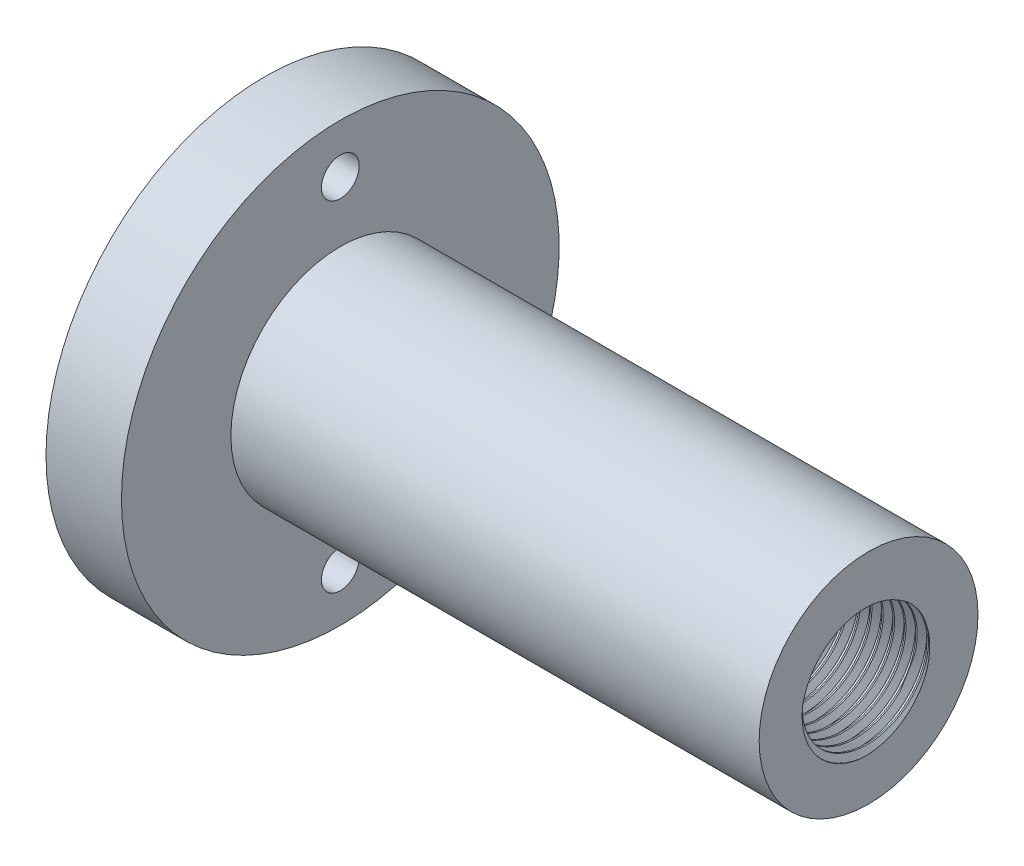
from build123d import *

# Parameters (mm, degrees)
CUT_EXTRUDE1_REACH             = 91.9
SKETCH2_R                      = 2.5
CUT_EXTRUDE1_DIRECTION_2_DEPTH = 90.899944383
THREAD1_PITCH                  = 1.5


with BuildPart() as part:
    # Sketch1 → Revolve1 (revolve)
    with BuildSketch(Plane.XY, mode=Mode.PRIVATE) as revolve1_sk:
        Polygon((-48, 29), (-38, 29), (-38, 14.5), (32, 14.5), (32, 8), (0, 8), (0, 13), (-44, 13), (-48, 17), align=None)
    revolve(revolve1_sk.sketch.rotate(Axis((0, 0, 0), (1, 0, 0)), 90), axis=Axis((0, 0, 0), (1, 0, 0)))

    # Sketch2 → Cut-Extrude1 (cut, up to next)
    with BuildSketch(Plane.ZY.offset(48), mode=Mode.PRIVATE) as cut_extrude1_sk1:
        with Locations(Location((0, 22.5, 0), (0, 0, 180))):
            Circle(SKETCH2_R)
    cut_extrude1_tool1 = extrude(cut_extrude1_sk1.sketch, amount=-CUT_EXTRUDE1_REACH, mode=Mode.PRIVATE) & part.part
    # Sketch2 → Cut-Extrude1 (cut, up to next)
    with BuildSketch(Plane.ZY.offset(48), mode=Mode.PRIVATE) as cut_extrude1_sk2:
        with Locations(Location((0, -22.5, 0), (0, 0, 180))):
            Circle(SKETCH2_R)
    cut_extrude1_tool2 = extrude(cut_extrude1_sk2.sketch, amount=-CUT_EXTRUDE1_REACH, mode=Mode.PRIVATE) & part.part
    add(cut_extrude1_tool1.solids().sort_by_distance((-48, 22.5, 0))[0], mode=Mode.SUBTRACT)
    add(cut_extrude1_tool2.solids().sort_by_distance((-48, -22.5, 0))[0], mode=Mode.SUBTRACT)

    # Sketch2 → Cut-Extrude1 direction 2 (cut)
    with BuildSketch(Plane.ZY.offset(48)):
        with Locations(Location((0, 22.5, 0), (0, 0, 180))):
            Circle(SKETCH2_R)
        with Locations(Location((0, -22.5, 0), (0, 0, 180))):
            Circle(SKETCH2_R)
    extrude(amount=CUT_EXTRUDE1_DIRECTION_2_DEPTH, mode=Mode.SUBTRACT)

    # Thread1: the profile of Thread Profile1 profile screwed along a right-hand helix of 103.333333 turns, 6 arcs to a turn; built about Z, then put on its axis
    thread1_z = Axis((0, 0, 0), (0, 0, 1))
    thread1_corners = [(7.9997, 0, -0.000173205), (7.9997, 0, 1.312673201), (8.811898812, 0, 0.843749998), (8.811898812, 0, 0.468749998)]
    with BuildLine(mode=Mode.PRIVATE) as thread1_profile:
        Line(thread1_corners[0], thread1_corners[1])
        Line(thread1_corners[1], thread1_corners[2])
        Line(thread1_corners[2], thread1_corners[3])
        Line(thread1_corners[3], thread1_corners[0])
    thread1_cap = Face(thread1_profile.wire())
    thread1_turn_angles = [0, 30, 60, 90, 120, 150, 180, 210, 240, 270, 300, 330, 360, 390, 420, 450, 480, 510, 540, 570, 600, 630, 660, 690, 720, 750, 780, 810, 840, 870, 900, 930, 960, 990, 1020, 1050, 1080, 1110, 1140, 1170, 1200, 1230, 1260, 1290, 1320, 1350, 1380, 1410, 1440]
    thread1_turn_weights = [1, 0.8660254037844387, 1, 0.8660254037844387, 1, 0.8660254037844387, 1, 0.8660254037844387, 1, 0.8660254037844387, 1, 0.8660254037844387, 1, 0.8660254037844387, 1, 0.8660254037844387, 1, 0.8660254037844387, 1, 0.8660254037844387, 1, 0.8660254037844387, 1, 0.8660254037844387, 1, 0.8660254037844387, 1, 0.8660254037844387, 1, 0.8660254037844387, 1, 0.8660254037844387, 1, 0.8660254037844387, 1, 0.8660254037844387, 1, 0.8660254037844387, 1, 0.8660254037844387, 1, 0.8660254037844387, 1, 0.8660254037844387, 1, 0.8660254037844387, 1, 0.8660254037844387, 1]
    thread1_turn_rails = [Edge.make_bspline([Vector(p[0], p[1], 0).rotate(thread1_z, thread1_turn_angles[k]) / thread1_turn_weights[k] + Vector(0, 0, p[2] + THREAD1_PITCH * thread1_turn_angles[k] / 360) for k in range(49)], [0, 0, 0, 1, 1, 2, 2, 3, 3, 4, 4, 5, 5, 6, 6, 7, 7, 8, 8, 9, 9, 10, 10, 11, 11, 12, 12, 13, 13, 14, 14, 15, 15, 16, 16, 17, 17, 18, 18, 19, 19, 20, 20, 21, 21, 22, 22, 23, 23, 24, 24, 24], 2, thread1_turn_weights) for p in thread1_corners]
    thread1_turn_sides = [Face.make_surface_from_curves(thread1_turn_rails[p[0]], thread1_turn_rails[p[1]]) for p in [(0, 1), (1, 2), (2, 3), (3, 0)]]
    thread1_last_angles = [36000, 36030, 36060, 36090, 36120, 36150, 36180, 36210, 36240, 36270, 36300, 36330, 36360, 36390, 36420, 36450, 36480, 36510, 36540, 36570, 36600, 36630, 36660, 36690, 36720, 36750, 36780, 36810, 36840, 36870, 36900, 36930, 36960, 36990, 37020, 37050, 37080, 37110, 37140, 37170, 37200]
    thread1_last_weights = [1, 0.8660254037844387, 1, 0.8660254037844387, 1, 0.8660254037844387, 1, 0.8660254037844387, 1, 0.8660254037844387, 1, 0.8660254037844387, 1, 0.8660254037844387, 1, 0.8660254037844387, 1, 0.8660254037844387, 1, 0.8660254037844387, 1, 0.8660254037844387, 1, 0.8660254037844387, 1, 0.8660254037844387, 1, 0.8660254037844387, 1, 0.8660254037844387, 1, 0.8660254037844387, 1, 0.8660254037844387, 1, 0.8660254037844387, 1, 0.8660254037844387, 1, 0.8660254037844703, 1]
    thread1_last_rails = [Edge.make_bspline([Vector(p[0], p[1], 0).rotate(thread1_z, thread1_last_angles[k]) / thread1_last_weights[k] + Vector(0, 0, p[2] + THREAD1_PITCH * thread1_last_angles[k] / 360) for k in range(41)], [0, 0, 0, 1, 1, 2, 2, 3, 3, 4, 4, 5, 5, 6, 6, 7, 7, 8, 8, 9, 9, 10, 10, 11, 11, 12, 12, 13, 13, 14, 14, 15, 15, 16, 16, 17, 17, 18, 18, 19, 19, 20, 20, 20], 2, thread1_last_weights) for p in thread1_corners]
    thread1_last_sides = [Face.make_surface_from_curves(thread1_last_rails[p[0]], thread1_last_rails[p[1]]) for p in [(0, 1), (1, 2), (2, 3), (3, 0)]]
    thread1 = Plane(origin=(37, 0, 0), x_dir=(0, 0, 1), z_dir=(-1, 0, 0)) * Solid(Shell([*[p.moved(Location((0, 0, 4 * THREAD1_PITCH * i))) for i in range(25) for p in thread1_turn_sides], *thread1_last_sides, thread1_cap, thread1_cap.rotate(thread1_z, 37200).moved(Location((0, 0, THREAD1_PITCH * 37200 / 360)))]))
    add(thread1, mode=Mode.SUBTRACT)


solid = part.part
